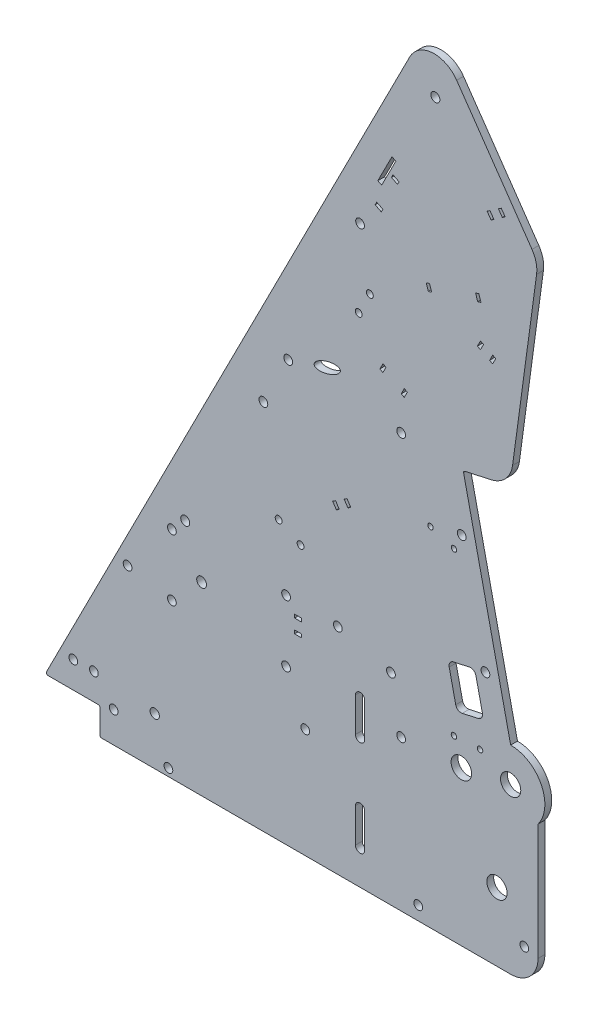
from build123d import *

# Parameters (mm, degrees)
BOSS_EXTRUDE1_DEPTH     = 3.175
SKETCH2_R               = 2.0955
SKETCH2_R_2             = 2.286
SKETCH2_R_3             = 2.032
SKETCH2_R_4             = 4.699
CUT_EXTRUDE1_DEPTH      = 421.976111717
SKETCH7_R               = 2.159
CUT_EXTRUDE2_DEPTH      = 421.976111717
CUT_EXTRUDE3_REACH      = 422.976
SKETCH10_R              = 2.032
FILLET1_R               = 12.7
FILLET2_R               = 0.79375
SKETCH12_R              = 2.032
CUT_EXTRUDE5_DEPTH      = 411.989226146
SKETCH13_R              = 2.032
SKETCH13_R_2            = 1.6
SKETCH13_RX             = 6.35
SKETCH13_RY             = 2.38125
SKETCH13_W              = 3.175
SKETCH13_H              = 1.5875
CUT_EXTRUDE6_DEPTH      = 411.989226146
CUT_EXTRUDE7_DEPTH      = 411.989226285
CUT_EXTRUDE7_DEPTH_BACK = 411.989226285
SKETCH14_R              = 1.27
SKETCH14_R_2            = 2.032
FILLET3_R               = 2.54
SKETCH15_R              = 4.7625
CUT_EXTRUDE8_DEPTH      = 411.989226285


with BuildPart() as part:
    # Sketch1 → Boss-Extrude1 (new body)
    with BuildSketch(Plane.XY):
        with BuildLine():
            Line((228.6, -12.7), (228.6, 53.975))
            ThreePointArc((228.6, 53.975), (230.099031657, 70.599515829), (215.9, 79.375))
            Line((215.9, 79.375), (193.909735224, 178.566674323))
            Line((193.909735224, 178.566674323), (215.607913982, 183.377044743))
            Line((215.607913982, 183.377044743), (228.6, 279.4))
            Line((228.6, 279.4), (178.754725958, 351.413083686))
            Line((178.754725958, 351.413083686), (0, 0))
            Line((0, 0), (25.4, 0))
            Line((25.4, 0), (25.4, -12.7))
            Line((25.4, -12.7), (228.6, -12.7))
        make_face()
    extrude(amount=BOSS_EXTRUDE1_DEPTH)

    # Sketch2 → Cut-Extrude1 (cut, through all)
    with BuildSketch(Plane.XY.offset(3.175)):
        with Locations((64.943150167, 94.057839899)):
            Circle(SKETCH2_R)
        with Locations((180.975, 322.164313376)):
            Circle(SKETCH2_R)
        with Locations((72.544547852, 73.173171402)):
            Circle(SKETCH2_R_2)
        with Locations((193.207821773, 152.394364194)):
            Circle(SKETCH2_R_3)
        with Locations((215.9, 63.5)):
            Circle(SKETCH2_R_4)
        with Locations((173.0375, -6.35)):
            Circle(SKETCH2_R_3)
        with Locations((204.202954161, 102.798527032)):
            Circle(SKETCH2_R_3)
        with Locations((209.55, 19.05)):
            Circle(SKETCH2_R_4)
        with Locations((165.1, 179.3875)):
            Circle(SKETCH2_R_3)
        with Locations((111.724047852, 87.460671402)):
            Circle(SKETCH2_R_3)
        with Locations((111.724047852, 58.885671402)):
            Circle(SKETCH2_R_3)
        with Locations((58.765047852, 58.885671402)):
            Circle(SKETCH2_R_3)
        with Locations((58.765047852, 87.460671402)):
            Circle(SKETCH2_R_3)
    extrude(amount=-CUT_EXTRUDE1_DEPTH, mode=Mode.SUBTRACT)

    # Sketch7 → Cut-Extrude2 (cut, through all)
    with BuildSketch(Plane.XY.offset(3.175)):
        with Locations((50.8, 9.525)):
            Circle(SKETCH7_R)
        with BuildLine():
            Line((143.891, 3.175), (143.891, 19.05))
            ThreePointArc((143.891, 19.05), (146.05, 21.209), (148.209, 19.05))
            Line((148.209, 19.05), (148.209, 3.175))
            ThreePointArc((148.209, 3.175), (146.05, 1.016), (143.891, 3.175))
        make_face()
        with BuildLine():
            Line((143.891, 47.625), (143.891, 63.5))
            ThreePointArc((143.891, 63.5), (146.05, 65.659), (148.209, 63.5))
            Line((148.209, 63.5), (148.209, 47.625))
            ThreePointArc((148.209, 47.625), (146.05, 45.466), (143.891, 47.625))
        make_face()
    extrude(amount=-CUT_EXTRUDE2_DEPTH, mode=Mode.SUBTRACT)

    # Sketch10 → Cut-Extrude3 (cut, up to next)
    with BuildSketch(Plane.XY.offset(3.175), mode=Mode.PRIVATE) as cut_extrude3_sk1:
        with Locations((120.65, 38.1)):
            Circle(SKETCH10_R)
    cut_extrude3_tool1 = extrude(cut_extrude3_sk1.sketch, amount=-CUT_EXTRUDE3_REACH, mode=Mode.PRIVATE) & part.part
    # Sketch10 → Cut-Extrude3 (cut, up to next)
    with BuildSketch(Plane.XY.offset(3.175), mode=Mode.PRIVATE) as cut_extrude3_sk2:
        with Locations((165.1, 57.15)):
            Circle(SKETCH10_R)
    cut_extrude3_tool2 = extrude(cut_extrude3_sk2.sketch, amount=-CUT_EXTRUDE3_REACH, mode=Mode.PRIVATE) & part.part
    # Sketch10 → Cut-Extrude3 (cut, up to next)
    with BuildSketch(Plane.XY.offset(3.175), mode=Mode.PRIVATE) as cut_extrude3_sk3:
        with Locations((13.046467246, 12.334704411)):
            Circle(SKETCH10_R)
    cut_extrude3_tool3 = extrude(cut_extrude3_sk3.sketch, amount=-CUT_EXTRUDE3_REACH, mode=Mode.PRIVATE) & part.part
    # Sketch10 → Cut-Extrude3 (cut, up to next)
    with BuildSketch(Plane.XY.offset(3.175), mode=Mode.PRIVATE) as cut_extrude3_sk4:
        with Locations((22.571467246, 12.334704411)):
            Circle(SKETCH10_R)
    cut_extrude3_tool4 = extrude(cut_extrude3_sk4.sketch, amount=-CUT_EXTRUDE3_REACH, mode=Mode.PRIVATE) & part.part
    # Sketch10 → Cut-Extrude3 (cut, up to next)
    with BuildSketch(Plane.XY.offset(3.175), mode=Mode.PRIVATE) as cut_extrude3_sk5:
        with Locations((38.211447917, 62.639810909)):
            Circle(SKETCH10_R)
    cut_extrude3_tool5 = extrude(cut_extrude3_sk5.sketch, amount=-CUT_EXTRUDE3_REACH, mode=Mode.PRIVATE) & part.part
    add(cut_extrude3_tool1.solids().sort_by_distance((120.65, 38.1, 3.175))[0], mode=Mode.SUBTRACT)
    add(cut_extrude3_tool2.solids().sort_by_distance((165.1, 57.15, 3.175))[0], mode=Mode.SUBTRACT)
    add(cut_extrude3_tool3.solids().sort_by_distance((13.046467, 12.334704, 3.175))[0], mode=Mode.SUBTRACT)
    add(cut_extrude3_tool4.solids().sort_by_distance((22.571467, 12.334704, 3.175))[0], mode=Mode.SUBTRACT)
    add(cut_extrude3_tool5.solids().sort_by_distance((38.211448, 62.639811, 3.175))[0], mode=Mode.SUBTRACT)

    # Fillet1
    fillet1_edges = [part.edges().sort_by_distance(p)[0] for p in [
        (228.6, -12.7, 1.5875),
        (178.754725958, 351.413083686, 1.5875),
        (215.607913982, 183.377044743, 1.5875),
        (228.6, 279.4, 1.5875),
    ]]
    fillet(fillet1_edges, radius=FILLET1_R)

    # Fillet2
    fillet2_edges = [part.edges().sort_by_distance(p)[0] for p in [
        (25.4, -12.7, 1.5875),
        (25.4, 0, 1.5875),
        (193.909735224, 178.566674323, 1.5875),
        (0, 0, 1.5875),
    ]]
    fillet(fillet2_edges, radius=FILLET2_R)

    # Sketch12 → Cut-Extrude5 (cut, through all)
    with BuildSketch(Plane.XY.offset(3.175)):
        with Locations((31.75, 1.5875)):
            Circle(SKETCH12_R)
        with Locations((173.0375, -6.35)):
            Circle(SKETCH12_R)
        with Locations((222.25, 1.5875)):
            Circle(SKETCH12_R)
        with Locations((57.15, -9.2075)):
            Circle(SKETCH12_R)
    extrude(amount=-CUT_EXTRUDE5_DEPTH, mode=Mode.SUBTRACT)

    # Sketch13 → Cut-Extrude6 (cut, through all)
    with BuildSketch(Plane.XY.offset(3.175)):
        with Locations((112.7125, 182.5625)):
            Circle(SKETCH13_R)
        with Locations((146.05, 254)):
            Circle(SKETCH13_R)
        with Locations((101.196445848, 159.923142748)):
            Circle(SKETCH13_R)
        with Locations((145.425401324, 217.737567137)):
            Circle(SKETCH13_R_2)
        with Locations((150.594024053, 227.898538502)):
            Circle(SKETCH13_R_2)
        with Locations((108.294003262, 116.150198589)):
            Circle(SKETCH13_R_2)
        with Locations((118.454974627, 110.981575859)):
            Circle(SKETCH13_R_2)
        with Locations(Location((130.826142263, 188.461522288), (0, 0, 18.038739462))):
            Ellipse(SKETCH13_RX, SKETCH13_RY)
        Polygon((178.26972852, 245.992253978), (176.758236028, 245.506922447), (177.728899089, 242.483937462), (179.240391581, 242.969268992), align=None)
        Polygon((160.847712251, 288.198438198), (154.283561384, 275.294004564), (156.066187939, 274.387228647), (162.630338806, 287.29166228), align=None)
        Polygon((200.609634347, 249.830809719), (202.12112684, 250.316141249), (201.150463779, 253.339126235), (199.638971286, 252.853794704), align=None)
        Polygon((160.590482388, 279.78010172), (163.420402045, 278.340594951), (164.140155429, 279.75555478), (161.310235773, 281.195061549), align=None)
        Polygon((153.789663007, 266.410402556), (153.069909623, 264.995442728), (155.899829279, 263.555935959), (156.619582664, 264.970895787), align=None)
        Polygon((203.330342332, 234.029927366), (201.915382504, 234.74968075), (200.475875735, 231.919761094), (201.890835563, 231.200007709), align=None)
        Polygon((206.135715047, 229.040747556), (207.550674876, 228.320994171), (208.990181645, 231.150913828), (207.575221816, 231.870667212), align=None)
        Polygon((211.540543439, 292.889033628), (210.235229039, 291.98553456), (212.042227175, 289.374905759), (213.347541575, 290.278404827), align=None)
        Polygon((206.319285837, 289.275037356), (205.013971437, 288.371538288), (206.820969573, 285.760909487), (208.126283974, 286.664408555), align=None)
        Polygon((133.35043444, 136.102010662), (135.081463368, 133.440401403), (136.412267998, 134.305915867), (134.681239069, 136.967525126), align=None)
        Polygon((155.228084113, 200.119678264), (156.643043941, 199.39992488), (158.08255071, 202.229844536), (156.667590882, 202.949597921), align=None)
        Polygon((165.132802911, 195.081404573), (166.547762739, 194.361651188), (167.987269508, 197.191570845), (166.57230968, 197.911324229), align=None)
        Polygon((140.404681887, 136.90245926), (138.673652958, 139.564068519), (140.004457588, 140.429582984), (141.735486516, 137.767973724), align=None)
        with Locations((117.248547852, 81.078921402)):
            Rectangle(SKETCH13_W, SKETCH13_H)
        with Locations((117.248547852, 74.728921402)):
            Rectangle(SKETCH13_W, SKETCH13_H)
    extrude(amount=-CUT_EXTRUDE6_DEPTH, mode=Mode.SUBTRACT)

    # Sketch14 → Cut-Extrude7 (cut, two sides: drawn at the far end of the back side and taken through both)
    with BuildSketch(Plane.XY.offset(3.175).offset(-CUT_EXTRUDE7_DEPTH_BACK)):
        with Locations((189.602197334, 69.980636704)):
            Circle(SKETCH14_R)
        with Locations((201.708862449, 70.509225118)):
            Circle(SKETCH14_R)
        with Locations((160.371381984, 80.729624765)):
            Circle(SKETCH14_R_2)
        with Locations((135.72976248, 86.89002964)):
            Circle(SKETCH14_R_2)
        with Locations((178.721644858, 148.532438598)):
            Circle(SKETCH14_R)
        with Locations((189.622629605, 145.09537131)):
            Circle(SKETCH14_R)
        Polygon((186.844411154, 98.950230697), (199.243370445, 101.699013794), (203.36654509, 83.100574858), (190.9675858, 80.351791761), align=None)
    extrude(amount=CUT_EXTRUDE7_DEPTH + CUT_EXTRUDE7_DEPTH_BACK, mode=Mode.SUBTRACT)

    # Fillet3
    fillet3_edges = [part.edges().sort_by_distance(p)[0] for p in [
        (199.243370445, 101.699013794, 1.5875),
        (186.844411154, 98.950230697, 1.5875),
        (190.9675858, 80.351791761, 1.5875),
        (203.36654509, 83.100574858, 1.5875),
    ]]
    fillet(fillet3_edges, radius=FILLET3_R)

    # Sketch15 → Cut-Extrude8 (cut, through all)
    with BuildSketch(Plane.XY.offset(3.175)):
        with Locations((193.04, 58.801)):
            Circle(SKETCH15_R)
    extrude(amount=-CUT_EXTRUDE8_DEPTH, mode=Mode.SUBTRACT)


solid = part.part
